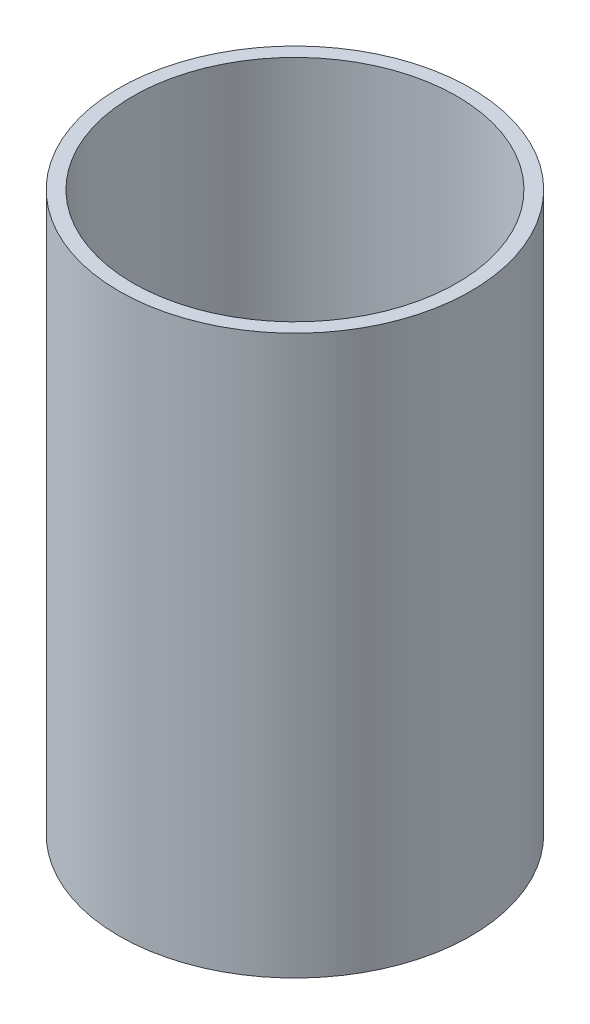
from build123d import *

# Parameters (mm, degrees)
ESQUISSE1_R        = 31.5
ESQUISSE1_R_2      = 29
BOSS_EXTRU_1_DEPTH = 100


with BuildPart() as part:
    # Esquisse1 → Boss.-Extru.1 (new body)
    with BuildSketch(Plane(origin=(0, 0, 0), x_dir=(1, 0, 0), z_dir=(0, 1, 0))):
        Circle(ESQUISSE1_R)
        Circle(ESQUISSE1_R_2, mode=Mode.SUBTRACT)
    extrude(amount=BOSS_EXTRU_1_DEPTH)


solid = part.part
